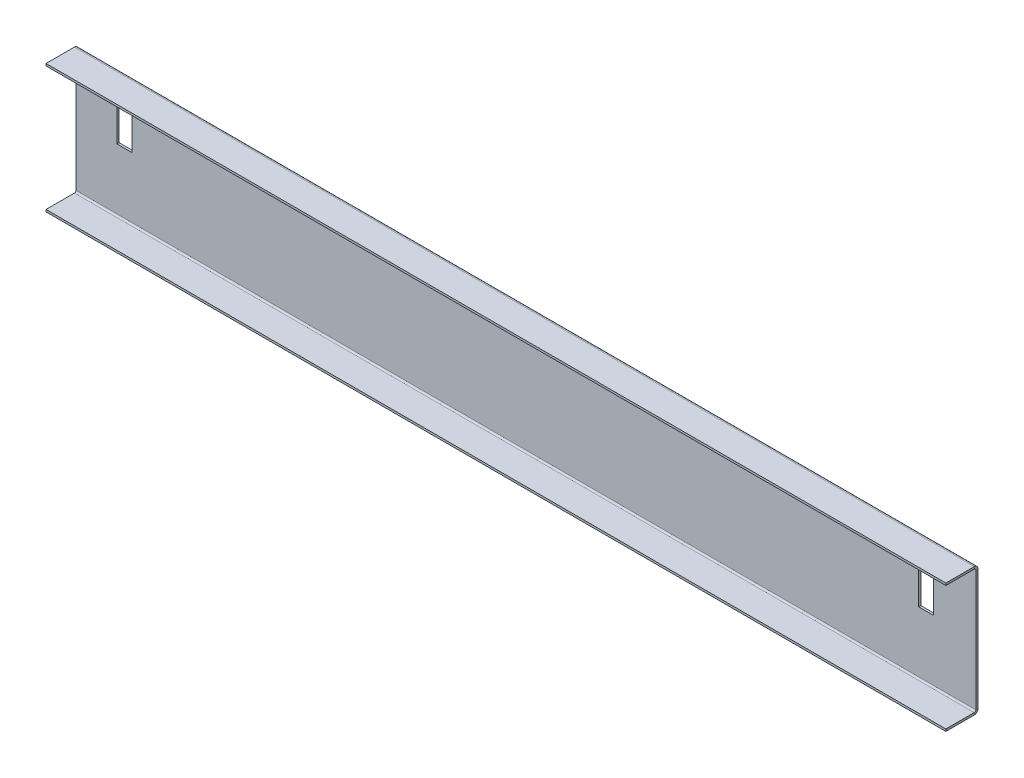
from build123d import *

# Parameters (mm, degrees)
SKETCH1_W                    = 420
SKETCH1_H                    = 60
BASE_FLANGE1_DEPTH           = 1
EDGE_FLANGE1_STRIP_W         = 5.4732
EDGE_FLANGE1_STRIP_H         = 1
EDGE_FLANGE1_STRIP_CUT_DEPTH = 420
EDGE_FLANGE1_DEPTH           = 420
EDGE_FLANGE2_STRIP_W         = 5.4732
EDGE_FLANGE2_STRIP_H         = 1
EDGE_FLANGE2_STRIP_CUT_DEPTH = 420
EDGE_FLANGE2_DEPTH           = 420
SKETCH12_W                   = 7
SKETCH12_H                   = 20
CUT_EXTRUDE1_DEPTH           = 217.028384653


# Sheet-metal steps are written as plain solids
with BuildPart() as part:
    # Sketch1 → Base-Flange1 (new body)
    with BuildSketch(Plane.XY):
        with Locations((0, 18.705882353)):
            Rectangle(SKETCH1_W, SKETCH1_H)
    extrude(amount=-BASE_FLANGE1_DEPTH)

    # Edge-Flange1 strip (across the edge) → Edge-Flange1 strip cut (cut)
    with BuildSketch(Plane(origin=(210, 48.705882353, 0), x_dir=(0, -1, 0), z_dir=(-1, 0, 0))):
        with Locations((-1, -0.5)):
            Rectangle(EDGE_FLANGE1_STRIP_W, EDGE_FLANGE1_STRIP_H)
    extrude(amount=EDGE_FLANGE1_STRIP_CUT_DEPTH, mode=Mode.SUBTRACT)

    # Edge-Flange1 section (across the edge) → Edge-Flange1 (add)
    with BuildSketch(Plane(origin=(210, 48.705882353, 0), x_dir=(0, -1, 0), z_dir=(-1, 0, 0))):
        with BuildLine():
            Line((0, 0.7366), (0, 14))
            Line((0, 14), (1, 14))
            Line((1, 14), (1, 0.7366))
            ThreePointArc((1, 0.7366), (1.215745145, 0.215745145), (1.7366, 0))
            Line((1.7366, 0), (1.7366, -1))
            ThreePointArc((1.7366, -1), (0.508638364, -0.491361636), (0, 0.7366))
        make_face()
    extrude(amount=EDGE_FLANGE1_DEPTH)

    # Edge-Flange2 strip (across the edge) → Edge-Flange2 strip cut (cut)
    with BuildSketch(Plane(origin=(-210, -11.294117647, 0), x_dir=(0, 1, 0), z_dir=(1, 0, 0))):
        with Locations((-1, -0.5)):
            Rectangle(EDGE_FLANGE2_STRIP_W, EDGE_FLANGE2_STRIP_H)
    extrude(amount=EDGE_FLANGE2_STRIP_CUT_DEPTH, mode=Mode.SUBTRACT)

    # Edge-Flange2 section (across the edge) → Edge-Flange2 (add)
    with BuildSketch(Plane(origin=(-210, -11.294117647, 0), x_dir=(0, 1, 0), z_dir=(1, 0, 0))):
        with BuildLine():
            Line((0, 0.7366), (0, 14))
            Line((0, 14), (1, 14))
            Line((1, 14), (1, 0.7366))
            ThreePointArc((1, 0.7366), (1.215745145, 0.215745145), (1.7366, 0))
            Line((1.7366, 0), (1.7366, -1))
            ThreePointArc((1.7366, -1), (0.508638364, -0.491361636), (0, 0.7366))
        make_face()
    extrude(amount=EDGE_FLANGE2_DEPTH)

    # Sketch12 → Cut-Extrude1 (cut, through all)
    with BuildSketch(Plane.XY):
        with Locations((186.818027369, 28.75)):
            Rectangle(SKETCH12_W, SKETCH12_H)
        with Locations((-187.355, 28.75)):
            Rectangle(SKETCH12_W, SKETCH12_H)
    extrude(amount=-CUT_EXTRUDE1_DEPTH, mode=Mode.SUBTRACT)


solid = part.part
